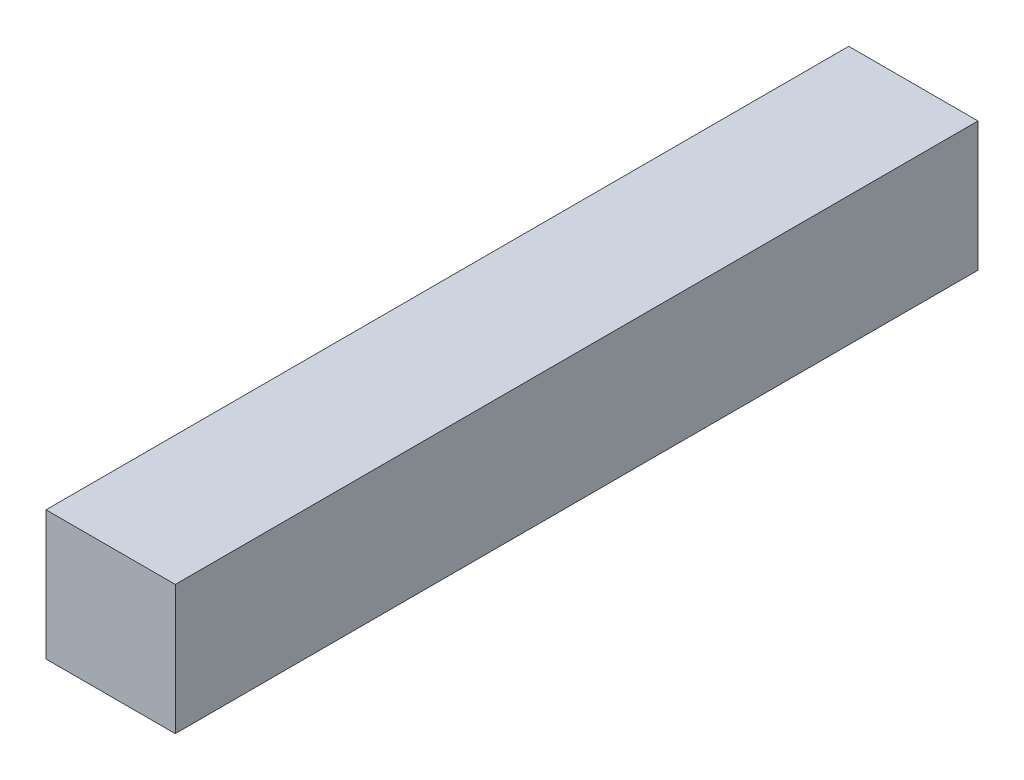
from build123d import *

# Parameters (mm, degrees)
SKETCH1_W           = 25.4
SKETCH1_H           = 25.4
BOSS_EXTRUDE1_DEPTH = 78.867


with BuildPart() as part:
    # Sketch1 → Boss-Extrude1 (new, symmetric)
    with BuildSketch(Plane.XY):
        Rectangle(SKETCH1_W, SKETCH1_H)
    extrude(amount=BOSS_EXTRUDE1_DEPTH, both=True)


solid = part.part
